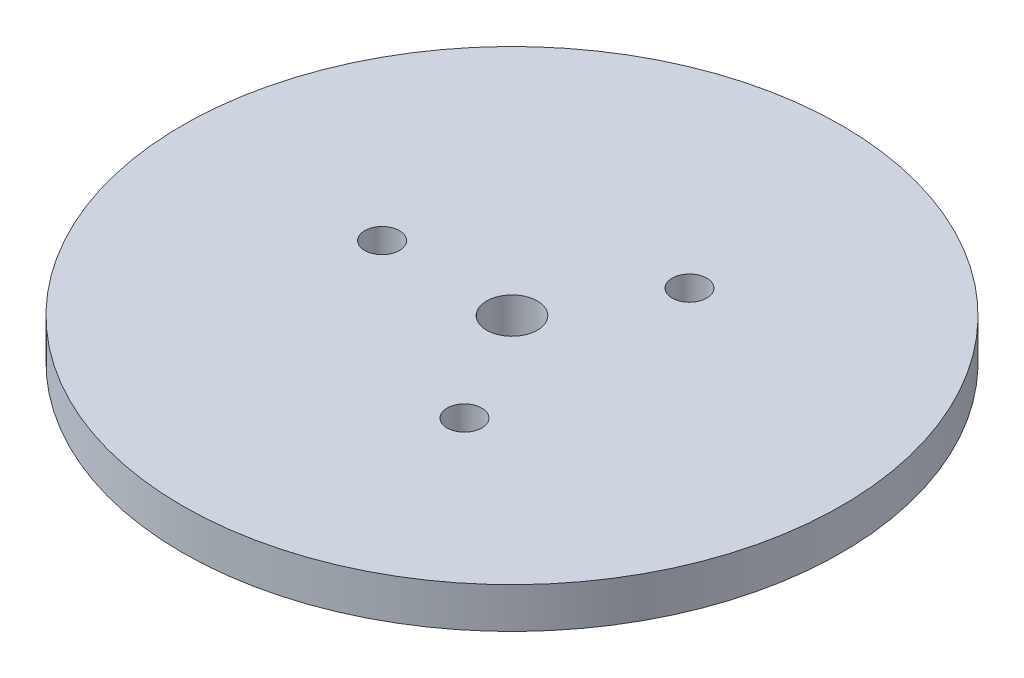
from build123d import *

# Parameters (mm, degrees)
SKETCH1_R           = 65
BOSS_EXTRUDE1_DEPTH = 8
SKETCH2_R           = 5
CUT_EXTRUDE1_DEPTH  = 93.271338995
SKETCH3_R           = 3.416521076
CUT_EXTRUDE2_DEPTH  = 6.859098376
CIRPATTERN1_COUNT   = 3


with BuildPart() as part:
    # Sketch1 → Boss-Extrude1 (new body)
    with BuildSketch(Plane(origin=(0, 0, 0), x_dir=(1, 0, 0), z_dir=(0, 1, 0))):
        Circle(SKETCH1_R)
    extrude(amount=BOSS_EXTRUDE1_DEPTH)

    # Sketch2 → Cut-Extrude1 (cut, through all)
    with BuildSketch(Plane(origin=(0, 0, 0), x_dir=(1, 0, 0), z_dir=(0, 1, 0))):
        Circle(SKETCH2_R)
    extrude(amount=CUT_EXTRUDE1_DEPTH, mode=Mode.SUBTRACT)

    # Sketch3 → Cut-Extrude2 (cut)
    with BuildSketch(Plane(origin=(0, 8, 0), x_dir=(1, 0, 0), z_dir=(0, 1, 0))):
        with Locations((-25.621794116, 0)):
            Circle(SKETCH3_R)
    cut_extrude2 = extrude(amount=-CUT_EXTRUDE2_DEPTH, mode=Mode.SUBTRACT)

    # CirPattern1: Cut-Extrude2 ×3 about axis
    cirpattern1_axis = Axis((0, 0, 0), (0, 1, 0))
    for i in range(1, CIRPATTERN1_COUNT):
        add(cut_extrude2.rotate(cirpattern1_axis, i * 360 / CIRPATTERN1_COUNT), mode=Mode.SUBTRACT)


solid = part.part
